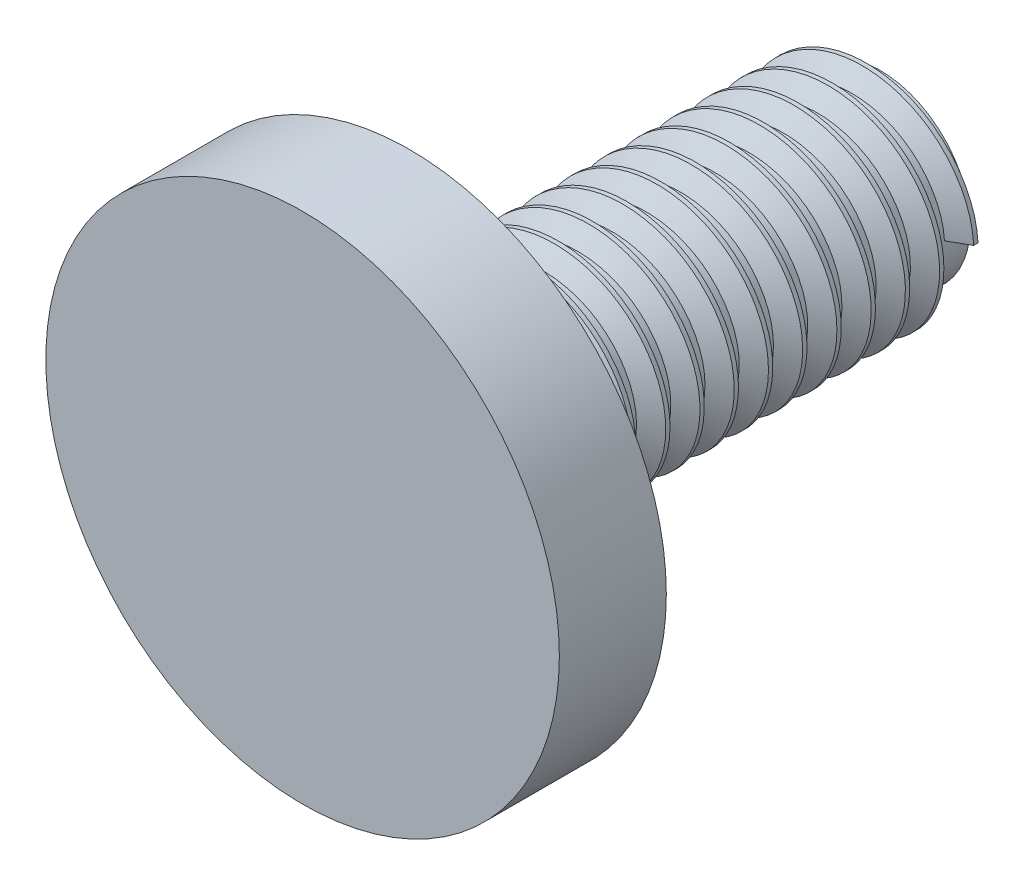
from build123d import *

# Parameters (mm, degrees)
SKETCH_1_R      = 6
EXTRUDE_1_DEPTH = 2.5
SKETCH_2_R      = 2.1
EXTRUDE_2_DEPTH = 11
THREAD_2_PITCH  = 0.8


with BuildPart() as part:
    # 草图1 → 凸台-拉伸1 (new body)
    with BuildSketch(Plane.XY):
        Circle(SKETCH_1_R)
    extrude(amount=EXTRUDE_1_DEPTH)

    # 草图2 → 凸台-拉伸2 (add)
    with BuildSketch(Plane.XY):
        Circle(SKETCH_2_R)
    extrude(amount=-EXTRUDE_2_DEPTH)

    # 螺纹线2: the profile of 螺纹线轮廓3 profile screwed along a right-hand helix of 13.75 turns, 8 arcs to a turn; built about Z, then put on its axis
    thread_2_z = Axis((0, 0, 0), (0, 0, 1))
    thread_2_corners = [(2.0997, 0, -0.000173205), (2.5330127, 0, 0.249999999), (2.5330127, 0, 0.349999999), (2.0997, 0, 0.600173203)]
    with BuildLine(mode=Mode.PRIVATE) as thread_2_profile:
        Line(thread_2_corners[0], thread_2_corners[1])
        Line(thread_2_corners[1], thread_2_corners[2])
        Line(thread_2_corners[2], thread_2_corners[3])
        Line(thread_2_corners[3], thread_2_corners[0])
    thread_2_cap = Face(thread_2_profile.wire())
    thread_2_turn_angles = [0, 22.5, 45, 67.5, 90, 112.5, 135, 157.5, 180, 202.5, 225, 247.5, 270, 292.5, 315, 337.5, 360]
    thread_2_turn_weights = [1, 0.9238795325112867, 1, 0.9238795325112867, 1, 0.9238795325112867, 1, 0.9238795325112867, 1, 0.9238795325112867, 1, 0.9238795325112867, 1, 0.9238795325112867, 1, 0.9238795325112867, 1]
    thread_2_turn_rails = [Edge.make_bspline([Vector(p[0], p[1], 0).rotate(thread_2_z, thread_2_turn_angles[k]) / thread_2_turn_weights[k] + Vector(0, 0, p[2] + THREAD_2_PITCH * thread_2_turn_angles[k] / 360) for k in range(17)], [0, 0, 0, 1, 1, 2, 2, 3, 3, 4, 4, 5, 5, 6, 6, 7, 7, 8, 8, 8], 2, thread_2_turn_weights) for p in thread_2_corners]
    thread_2_turn_sides = [Face.make_surface_from_curves(thread_2_turn_rails[p[0]], thread_2_turn_rails[p[1]]) for p in [(0, 1), (1, 2), (2, 3), (3, 0)]]
    thread_2_last_angles = [4680, 4702.5, 4725, 4747.5, 4770, 4792.5, 4815, 4837.5, 4860, 4882.5, 4905, 4927.5, 4950]
    thread_2_last_weights = [1, 0.9238795325112867, 1, 0.9238795325112867, 1, 0.9238795325112867, 1, 0.9238795325112867, 1, 0.9238795325112867, 1, 0.9238795325112867, 1]
    thread_2_last_rails = [Edge.make_bspline([Vector(p[0], p[1], 0).rotate(thread_2_z, thread_2_last_angles[k]) / thread_2_last_weights[k] + Vector(0, 0, p[2] + THREAD_2_PITCH * thread_2_last_angles[k] / 360) for k in range(13)], [0, 0, 0, 1, 1, 2, 2, 3, 3, 4, 4, 5, 5, 6, 6, 6], 2, thread_2_last_weights) for p in thread_2_corners]
    thread_2_last_sides = [Face.make_surface_from_curves(thread_2_last_rails[p[0]], thread_2_last_rails[p[1]]) for p in [(0, 1), (1, 2), (2, 3), (3, 0)]]
    thread_2 = Plane(origin=(0, 0, -11), x_dir=(1, 0, 0), z_dir=(0, 0, 1)) * Solid(Shell([*[p.moved(Location((0, 0, THREAD_2_PITCH * i))) for i in range(13) for p in thread_2_turn_sides], *thread_2_last_sides, thread_2_cap, thread_2_cap.rotate(thread_2_z, 4950).moved(Location((0, 0, THREAD_2_PITCH * 4950 / 360)))]))
    add(thread_2)


solid = part.part
